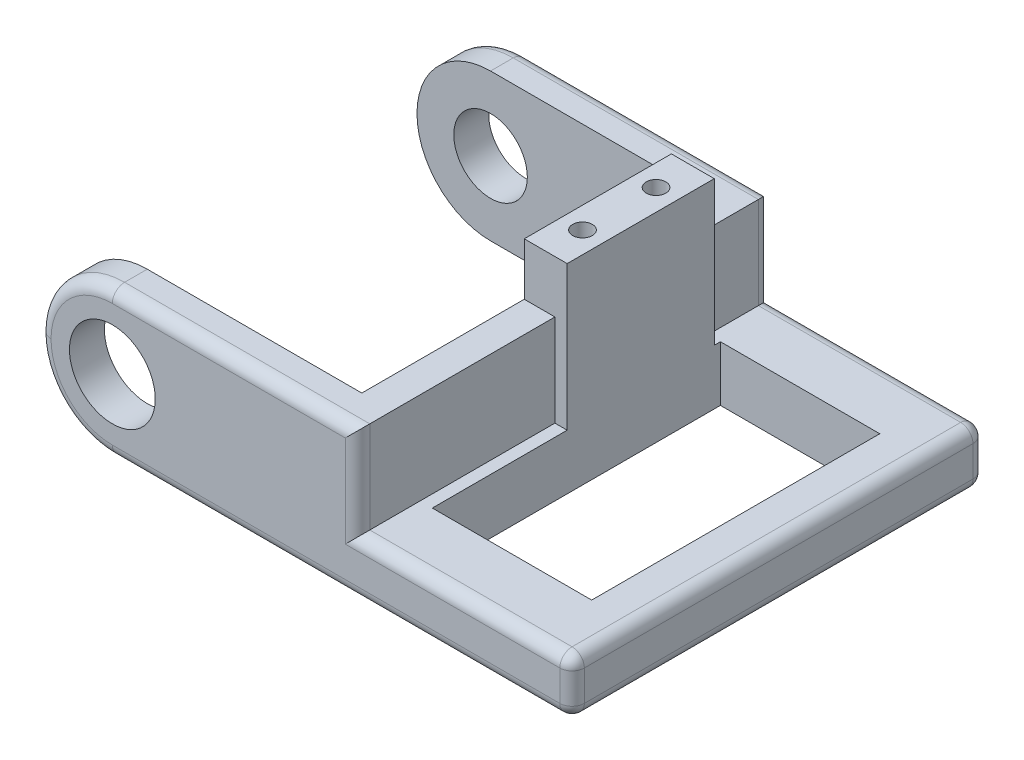
from build123d import *

# Parameters (mm, degrees)
SKETCH1_W           = 33.7
SKETCH1_H           = 12
BOSS_EXTRUDE1_DEPTH = 2.5
SKETCH2_W           = 33.7
SKETCH2_H           = 4.5
BOSS_EXTRUDE2_DEPTH = 17.5
SKETCH3_W           = 13
SKETCH3_H           = 23.5
CUT_EXTRUDE1_DEPTH  = 258.235074474
SKETCH4_W           = 2.85
SKETCH4_H           = 12
BOSS_EXTRUDE3_DEPTH = 23.5
FILLET1_R           = 6
SKETCH5_R           = 3.5
CUT_EXTRUDE2_DEPTH  = 4
SKETCH6_R           = 3
CUT_EXTRUDE3_DEPTH  = 4
SKETCH7_W           = 3.5
SKETCH7_H           = 12
BOSS_EXTRUDE4_DEPTH = 11.77
FILLET2_R           = 1
SKETCH8_R           = 0.8
CUT_EXTRUDE4_DEPTH  = 2


with BuildPart() as part:
    # Sketch1 → Boss-Extrude1 (new body)
    with BuildSketch(Plane(origin=(0, 0, 0), x_dir=(0, 0, -1), z_dir=(1, 0, 0))):
        with Locations((-239.496705732, 20.068965517)):
            Rectangle(SKETCH1_W, SKETCH1_H)
    extrude(amount=BOSS_EXTRUDE1_DEPTH)

    # Sketch2 → Boss-Extrude2 (add)
    with BuildSketch(Plane(origin=(2.5, 0, 0), x_dir=(0, 0, -1), z_dir=(1, 0, 0))):
        with Locations((-239.496705732, 16.318965517)):
            Rectangle(SKETCH2_W, SKETCH2_H)
    extrude(amount=BOSS_EXTRUDE2_DEPTH)

    # Sketch3 → Cut-Extrude1 (cut, through all)
    with BuildSketch(Plane(origin=(0, 18.568965517, 0), x_dir=(1, 0, 0), z_dir=(0, 1, 0))):
        with Locations((10, -239.496705732)):
            Rectangle(SKETCH3_W, SKETCH3_H)
    extrude(amount=-CUT_EXTRUDE1_DEPTH, mode=Mode.SUBTRACT)

    # Sketch4 → Boss-Extrude3 (add)
    with BuildSketch(Plane.ZY):
        with Locations((224.071705732, 20.068965517)):
            Rectangle(SKETCH4_W, SKETCH4_H)
        with Locations((254.921705732, 20.068965517)):
            Rectangle(SKETCH4_W, SKETCH4_H)
    extrude(amount=BOSS_EXTRUDE3_DEPTH)

    # Fillet1
    fillet1_edges = [part.edges().sort_by_distance(p)[0] for p in [
        (-23.5, 14.068965517, 224.071705732),
        (-23.5, 26.068965517, 224.071705732),
        (-23.5, 14.068965517, 254.921705732),
        (-23.5, 26.068965517, 254.921705732),
    ]]
    fillet(fillet1_edges, radius=FILLET1_R - 0.0001)  # a hair under: the kernel refuses the full size

    # Sketch5 → Cut-Extrude2 (cut)
    with BuildSketch(Plane.XY.offset(256.346705732)):
        with Locations((-17.5, 20.068965517)):
            Circle(SKETCH5_R)
    extrude(amount=-CUT_EXTRUDE2_DEPTH, mode=Mode.SUBTRACT)

    # Sketch6 → Cut-Extrude3 (cut)
    with BuildSketch(Plane.XY.offset(225.496705732)):
        with Locations((-17.5, 20.068965517)):
            Circle(SKETCH6_R)
    extrude(amount=-CUT_EXTRUDE3_DEPTH, mode=Mode.SUBTRACT)

    # Sketch7 → Boss-Extrude4 (add)
    with BuildSketch(Plane(origin=(0, 18.568965517, 0), x_dir=(1, 0, 0), z_dir=(0, 1, 0))):
        with Locations((1.75, -234.246705732)):
            Rectangle(SKETCH7_W, SKETCH7_H)
    extrude(amount=BOSS_EXTRUDE4_DEPTH)

    # Fillet2
    fillet2_edges = [part.edges().sort_by_distance(p)[0] for p in [
        (2.5, 22.318965517, 222.646705732),
        (11.25, 18.568965517, 256.346705732),
        (11.25, 18.568965517, 222.646705732),
        (20, 16.318965517, 256.346705732),
        (20, 14.068965517, 239.496705732),
        (20, 16.318965517, 222.646705732),
        (20, 18.568965517, 239.496705732),
        (2.5, 22.318965517, 256.346705732),
        (-21.742669976, 24.311635494, 222.646705732),
        (-21.742669976, 15.826295541, 222.646705732),
        (-21.742669976, 24.311635494, 256.346705732),
        (-21.742669976, 15.826295541, 256.346705732),
        (-7.50005, 26.068965517, 256.346705732),
        (-7.50005, 26.068965517, 222.646705732),
        (1.24995, 14.068965517, 222.646705732),
        (1.24995, 14.068965517, 256.346705732),
    ]]
    fillet(fillet2_edges, radius=FILLET2_R)

    # Sketch8 → Cut-Extrude4 (cut)
    with BuildSketch(Plane(origin=(0, 30.338965517, 0), x_dir=(1, 0, 0), z_dir=(0, 1, 0))):
        with Locations(Location((1.75, -231.246705732, 0), (0, 0, 270))):
            Circle(SKETCH8_R)
        with Locations(Location((1.75, -237.246705732, 0), (0, 0, 270))):
            Circle(SKETCH8_R)
    extrude(amount=-CUT_EXTRUDE4_DEPTH, mode=Mode.SUBTRACT)


solid = part.part
